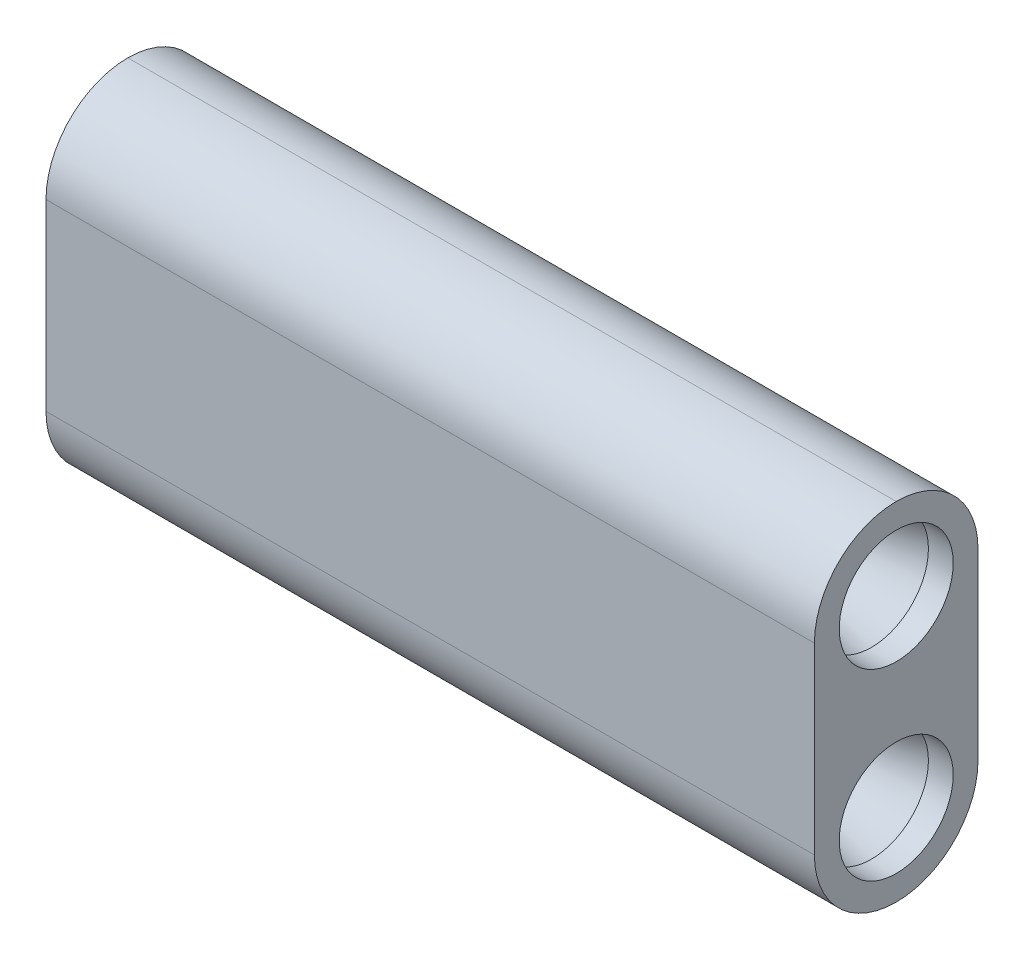
from build123d import *

# Parameters (mm, degrees)
SKETCH1_W                = 31
SKETCH1_H                = 14
BOSS_EXTRUDE1_DEPTH      = 6.6
SKETCH2_R                = 2.3
CUT_EXTRUDE1_DEPTH       = 1
ZAOBLIT7_R               = 3.3
ZAOBLIT12_R              = 3.3
ZAOBLIT13_R              = 3.3
ZAOBLIT14_R              = 3.3
ODEBRAT_START            = -1
SKICA1_R                 = 2.3
ODEBRAT_VYSUNUT_M1_DEPTH = 1
SKICA3_R                 = 2.3
ODEBRAT_VYSUNUT_M2_DEPTH = 3
ODEBRAT_VYSUNUT_M2_DRAFT = -15
SKICA4_R                 = 2.3
ODEBRAT_VYSUNUT_M3_DEPTH = 3
ODEBRAT_VYSUNUT_M3_DRAFT = -15
SKICA5_R                 = 2.3
ODEBRAT_VYSUNUT_M4_DEPTH = 3
ODEBRAT_VYSUNUT_M4_DRAFT = -15
SKICA6_R                 = 2.3
ODEBRAT_VYSUNUT_M5_DEPTH = 3
ODEBRAT_VYSUNUT_M5_DRAFT = -15


with BuildPart() as part:
    # Sketch1 → Boss-Extrude1 (new body)
    with BuildSketch(Plane.XY):
        with Locations((15.5, 7)):
            Rectangle(SKETCH1_W, SKETCH1_H)
    extrude(amount=BOSS_EXTRUDE1_DEPTH)

    # Sketch2 → Cut-Extrude1 (cut)
    with BuildSketch(Plane.ZY):
        with Locations((3.3, 10.7)):
            Circle(SKETCH2_R)
        with Locations((3.3, 3.3)):
            Circle(SKETCH2_R)
    extrude(amount=-CUT_EXTRUDE1_DEPTH, mode=Mode.SUBTRACT)

    # Zaoblit7
    zaoblit7_edges = [part.edges().sort_by_distance(p)[0] for p in [
        (15.5, 14, 0),
    ]]
    fillet(zaoblit7_edges, radius=ZAOBLIT7_R)

    # Zaoblit12
    zaoblit12_edges = [part.edges().sort_by_distance(p)[0] for p in [
        (15.5, 14, 6.6),
    ]]
    fillet(zaoblit12_edges, radius=ZAOBLIT12_R - 0.0001)  # a hair under: the kernel refuses the full size

    # Zaoblit13
    zaoblit13_edges = [part.edges().sort_by_distance(p)[0] for p in [
        (15.5, 0, 6.6),
    ]]
    fillet(zaoblit13_edges, radius=ZAOBLIT13_R)

    # Zaoblit14
    zaoblit14_edges = [part.edges().sort_by_distance(p)[0] for p in [
        (15.5, 0, 0),
    ]]
    fillet(zaoblit14_edges, radius=ZAOBLIT14_R - 0.0001)  # a hair under: the kernel refuses the full size

    # Skica1 → Odebrat vysunutím1 (cut)
    with BuildSketch(Plane(origin=(31, 0, 0), x_dir=(0, 0, -1), z_dir=(1, 0, 0)).offset(ODEBRAT_START)):
        with Locations(Location((-3.3, 10.7, 0), (0, 0, 180))):
            Circle(SKICA1_R)
        with Locations(Location((-3.3, 3.3, 0), (0, 0, 180))):
            Circle(SKICA1_R)
    extrude(amount=ODEBRAT_VYSUNUT_M1_DEPTH, mode=Mode.SUBTRACT)


with BuildPart() as odebrat_vysunut_m2_tool:
    # Skica3 → Odebrat vysunutím2 (with draft: the straight prism first)
    with BuildSketch(Plane.ZY.offset(-1)):
        with Locations((3.3, 10.7)):
            Circle(SKICA3_R)
    extrude(amount=-ODEBRAT_VYSUNUT_M2_DEPTH)
    # Odebrat vysunutím2: the draft: its side faces are tilted about the plane it starts from
    odebrat_vysunut_m2_sides = [odebrat_vysunut_m2_tool.faces().sort_by_distance(p)[0] for p in [
        (2.5, 10.7, 1),
    ]]
    draft(odebrat_vysunut_m2_sides, Plane.ZY.offset(-1), ODEBRAT_VYSUNUT_M2_DRAFT)


with BuildPart() as part_1:
    add(part.part)

    # Odebrat vysunutím2: cut by odebrat_vysunut_m2_tool
    add(odebrat_vysunut_m2_tool.part, mode=Mode.SUBTRACT)


with BuildPart() as odebrat_vysunut_m3_tool:
    # Skica4 → Odebrat vysunutím3 (with draft: the straight prism first)
    with BuildSketch(Plane.ZY.offset(-1)):
        with Locations((3.3, 3.3)):
            Circle(SKICA4_R)
    extrude(amount=-ODEBRAT_VYSUNUT_M3_DEPTH)
    # Odebrat vysunutím3: the draft: its side faces are tilted about the plane it starts from
    odebrat_vysunut_m3_sides = [odebrat_vysunut_m3_tool.faces().sort_by_distance(p)[0] for p in [
        (2.5, 3.3, 1),
    ]]
    draft(odebrat_vysunut_m3_sides, Plane.ZY.offset(-1), ODEBRAT_VYSUNUT_M3_DRAFT)


with BuildPart() as part_2:
    add(part_1.part)

    # Odebrat vysunutím3: cut by odebrat_vysunut_m3_tool
    add(odebrat_vysunut_m3_tool.part, mode=Mode.SUBTRACT)


with BuildPart() as odebrat_vysunut_m4_tool:
    # Skica5 → Odebrat vysunutím4 (with draft: the straight prism first)
    with BuildSketch(Plane(origin=(30, 0, 0), x_dir=(0, 0, -1), z_dir=(1, 0, 0))):
        with Locations(Location((-3.3, 10.7, 0), (0, 0, 180))):
            Circle(SKICA5_R)
    extrude(amount=-ODEBRAT_VYSUNUT_M4_DEPTH)
    # Odebrat vysunutím4: the draft: its side faces are tilted about the plane it starts from
    odebrat_vysunut_m4_sides = [odebrat_vysunut_m4_tool.faces().sort_by_distance(p)[0] for p in [
        (28.5, 10.7, 1),
    ]]
    draft(odebrat_vysunut_m4_sides, Plane(origin=(30, 0, 0), x_dir=(0, 0, -1), z_dir=(1, 0, 0)), ODEBRAT_VYSUNUT_M4_DRAFT)


with BuildPart() as part_3:
    add(part_2.part)

    # Odebrat vysunutím4: cut by odebrat_vysunut_m4_tool
    add(odebrat_vysunut_m4_tool.part, mode=Mode.SUBTRACT)


with BuildPart() as odebrat_vysunut_m5_tool:
    # Skica6 → Odebrat vysunutím5 (with draft: the straight prism first)
    with BuildSketch(Plane(origin=(30, 0, 0), x_dir=(0, 0, -1), z_dir=(1, 0, 0))):
        with Locations(Location((-3.3, 3.3, 0), (0, 0, 180))):
            Circle(SKICA6_R)
    extrude(amount=-ODEBRAT_VYSUNUT_M5_DEPTH)
    # Odebrat vysunutím5: the draft: its side faces are tilted about the plane it starts from
    odebrat_vysunut_m5_sides = [odebrat_vysunut_m5_tool.faces().sort_by_distance(p)[0] for p in [
        (28.5, 3.3, 1),
    ]]
    draft(odebrat_vysunut_m5_sides, Plane(origin=(30, 0, 0), x_dir=(0, 0, -1), z_dir=(1, 0, 0)), ODEBRAT_VYSUNUT_M5_DRAFT)


with BuildPart() as part_4:
    add(part_3.part)

    # Odebrat vysunutím5: cut by odebrat_vysunut_m5_tool
    add(odebrat_vysunut_m5_tool.part, mode=Mode.SUBTRACT)


solid = part_4.part
